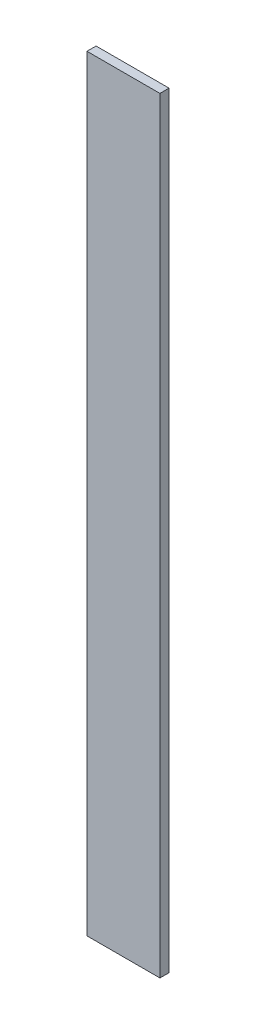
from build123d import *

# Parameters (mm, degrees)
ESQUISSE1_W        = 50.8
ESQUISSE1_H        = 533.4
BOSS_EXTRU_1_DEPTH = 6.35


with BuildPart() as part:
    # Esquisse1 → Boss.-Extru.1 (new body)
    with BuildSketch(Plane.XY):
        Rectangle(ESQUISSE1_W, ESQUISSE1_H)
    extrude(amount=BOSS_EXTRU_1_DEPTH)


solid = part.part
